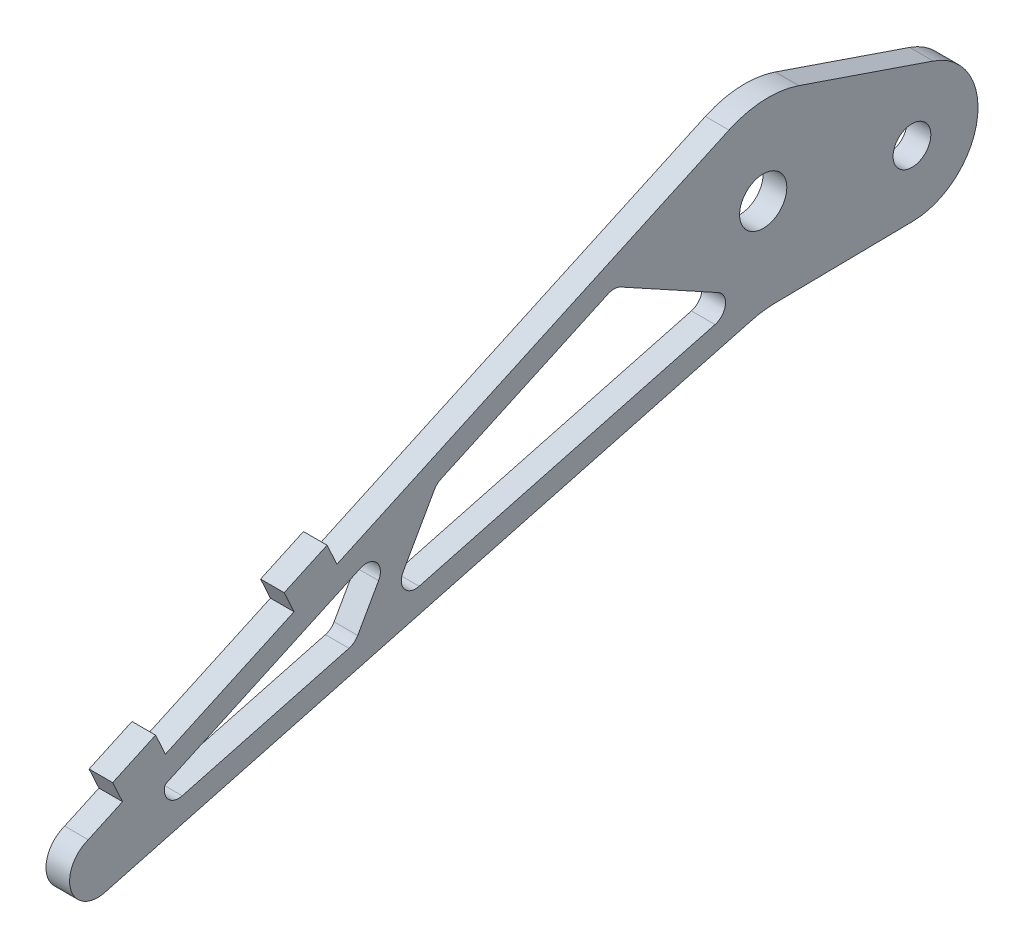
from build123d import *

# Parameters (mm, degrees)
SKETCH1_R           = 4
SKETCH1_R_2         = 5
BOSS_EXTRUDE1_DEPTH = 5
FILLET3_R           = 20
FILLET10_R          = 3


with BuildPart() as part:
    # Sketch1 → Boss-Extrude1 (new body)
    # profile 1 of 3: a face of its own
    with BuildSketch(Plane.YZ):
        with BuildLine():
            Line((-14.443258315, 31.513848096), (-13.998623919, -0.196286448))
            ThreePointArc((-13.998623919, -0.196286448), (-2.196477435, -13.826622396), (13.248647006, -4.52474889))
            Line((13.248647006, -4.52474889), (25.556741685, 31.513848096))
            Line((25.556741685, 31.513848096), (-15.913444308, 121.828294459))
            Line((-15.913444308, 121.828294459), (-17.991906384, 126.354803013))
            Line((-17.991906384, 126.354803013), (-20.086315573, 130.916041451))
            Line((-20.086315573, 130.916041451), (-32.596955812, 158.161917487))
            Line((-32.596955812, 158.161917487), (-34.683391444, 162.705790984))
            Line((-34.683391444, 162.705790984), (-36.769827077, 167.24966448))
            Line((-36.769827077, 167.24966448), (-40.108124089, 174.519862074))
            ThreePointArc((-40.108124089, 174.519862074), (-47.798400673, 178.105896939), (-51.384435538, 170.415620354))
            Line((-51.384435538, 170.415620354), (-14.443258315, 31.513848096))
        make_face()
        with Locations(Location((0, 0, 0), (0, 0, 270))):
            Circle(SKETCH1_R, mode=Mode.SUBTRACT)
        with Locations(Location((5.556741685, 31.513848096, 0), (0, 0, 270))):
            Circle(SKETCH1_R_2, mode=Mode.SUBTRACT)
        Polygon((-10.059219018, 34.483430451), (-30.486505123, 111.291655193), (-11.718080145, 100.709404741), (5.599975549, 62.99386104), align=None, mode=Mode.SUBTRACT)
        Polygon((-38.215011053, 158.414852351), (-15.274502195, 108.454638594), (-32.282363467, 118.044225778), (-44.116299331, 162.540768328), align=None, mode=Mode.SUBTRACT)
    # profile 2 of 3: a face of its own
    with BuildSketch(Plane.YZ):
        Polygon((-17.991906384, 126.354803013), (-15.913444308, 121.828294459), (-11.369603993, 123.914714855), (-15.542475258, 133.002461848), (-20.086315573, 130.916041451), align=None)
    # profile 3 of 3: a face of its own
    with BuildSketch(Plane.YZ):
        Polygon((-32.22595358, 169.336100113), (-36.769827077, 167.24966448), (-34.683391444, 162.705790984), (-32.596955812, 158.161917487), (-28.053082315, 160.24835312), align=None)
    extrude(amount=-BOSS_EXTRUDE1_DEPTH)

    # Fillet3
    fillet3_edges = [part.edges().sort_by_distance(p)[0] for p in [
        (-2.5, 25.556741685, 31.513848096),
        (-2.5, -14.443258315, 31.513848096),
    ]]
    fillet(fillet3_edges, radius=FILLET3_R)

    # Fillet10
    # the kernel refuses this fillet: 3 mm, written as the material it adds along each edge
    with BuildSketch(Plane(origin=(0, -38.215011053, 158.414852351), x_dir=(0, 0.41728712651347166, -0.9087746992770703), z_dir=(-1, 0, 0))) as fillet10_piece_1:
        with BuildLine():
            CenterArc((FILLET10_R * 0.271478941521, FILLET10_R), FILLET10_R, 239.62294962, 30.37705038)
            Line((-FILLET10_R * 0.23420930525, FILLET10_R * 0.137283709973), (0, 0))
            Line((0, 0), (FILLET10_R * 0.271478941521, 0))
        make_face()
    extrude(amount=5)
    with BuildSketch(Plane(origin=(0, -32.282363467, 118.044225778), x_dir=(0, 0.8710790696902164, -0.49114280443433855), z_dir=(-1, 0, 0))) as fillet10_piece_2:
        with BuildLine():
            CenterArc((FILLET10_R * 0.421297147858, -FILLET10_R), FILLET10_R, 90, 45.691106369)
            Line((-FILLET10_R * 0.294287167004, -FILLET10_R * 0.301473630904), (0, 0))
            Line((0, 0), (FILLET10_R * 0.421297147858, 0))
        make_face()
    extrude(amount=5)
    with BuildSketch(Plane(origin=(0, -30.486505123, 111.291655193), x_dir=(0, 0.25701761253564515, -0.9664067191645953), z_dir=(-1, 0, 0))) as fillet10_piece_3:
        with BuildLine():
            CenterArc((FILLET10_R * 2.37362157585, -FILLET10_R), FILLET10_R, 90, 134.308893631)
            Line((FILLET10_R * 1.65803726099, -FILLET10_R * 1.6985263691), (0, 0))
            Line((0, 0), (FILLET10_R * 2.37362157585, 0))
        make_face()
    extrude(amount=5)
    with BuildSketch(Plane(origin=(0, -11.718080145, 100.709404741), x_dir=(0, -0.8710790696902125, 0.4911428044343457), z_dir=(-1, 0, 0))) as fillet10_piece_4:
        with BuildLine():
            CenterArc((FILLET10_R * 0.324156203472, -FILLET10_R), FILLET10_R, 90, 35.920846961)
            Line((-FILLET10_R * 0.262510846562, -FILLET10_R * 0.190171763641), (0, 0))
            Line((0, 0), (FILLET10_R * 0.324156203472, 0))
        make_face()
    extrude(amount=5)
    with BuildSketch(Plane(origin=(0, -10.059219018, 34.483430451), x_dir=(0, -0.2570176125356449, 0.9664067191645953), z_dir=(-1, 0, 0))) as fillet10_piece_5:
        with BuildLine():
            CenterArc((FILLET10_R * 2.49571060233, FILLET10_R), FILLET10_R, 133.670716463, 136.329283537)
            Line((FILLET10_R * 1.80519778573, FILLET10_R * 1.72332015741), (0, 0))
            Line((0, 0), (FILLET10_R * 2.49571060233, 0))
        make_face()
    extrude(amount=5)
    with BuildSketch(Plane(origin=(0, 5.599975549, 62.99386104), x_dir=(0, -0.41728712651347205, 0.9087746992770702), z_dir=(-1, 0, 0))) as fillet10_piece_6:
        with BuildLine():
            CenterArc((FILLET10_R * 0.503395718442, -FILLET10_R), FILLET10_R, 90, 53.440975871)
            Line((-FILLET10_R * 0.299847949894, -FILLET10_R * 0.404349423506), (0, 0))
            Line((0, 0), (FILLET10_R * 0.503395718442, 0))
        make_face()
    extrude(amount=5)
    with BuildSketch(Plane(origin=(0, -15.274502195, 108.454638594), x_dir=(0, -0.4172871265134709, 0.9087746992770708), z_dir=(-1, 0, 0))) as fillet10_piece_7:
        with BuildLine():
            CenterArc((FILLET10_R * 3.08493247789, -FILLET10_R), FILLET10_R, 90, 144.079153039)
            Line((FILLET10_R * 2.49826542786, -FILLET10_R * 1.80982823636), (0, 0))
            Line((0, 0), (FILLET10_R * 3.08493247789, 0))
        make_face()
    extrude(amount=5)
    with BuildSketch(Plane(origin=(0, -44.116299331, 162.540768328), x_dir=(0, 0.2570176125356455, -0.9664067191645951), z_dir=(-1, 0, 0))) as fillet10_piece_8:
        with BuildLine():
            CenterArc((FILLET10_R * 2.73652664972, -FILLET10_R), FILLET10_R, 90, 139.852690212)
            Line((FILLET10_R * 2.09177163516, -FILLET10_R * 1.76438927988), (0, 0))
            Line((0, 0), (FILLET10_R * 2.73652664972, 0))
        make_face()
    extrude(amount=5)


solid = part.part
